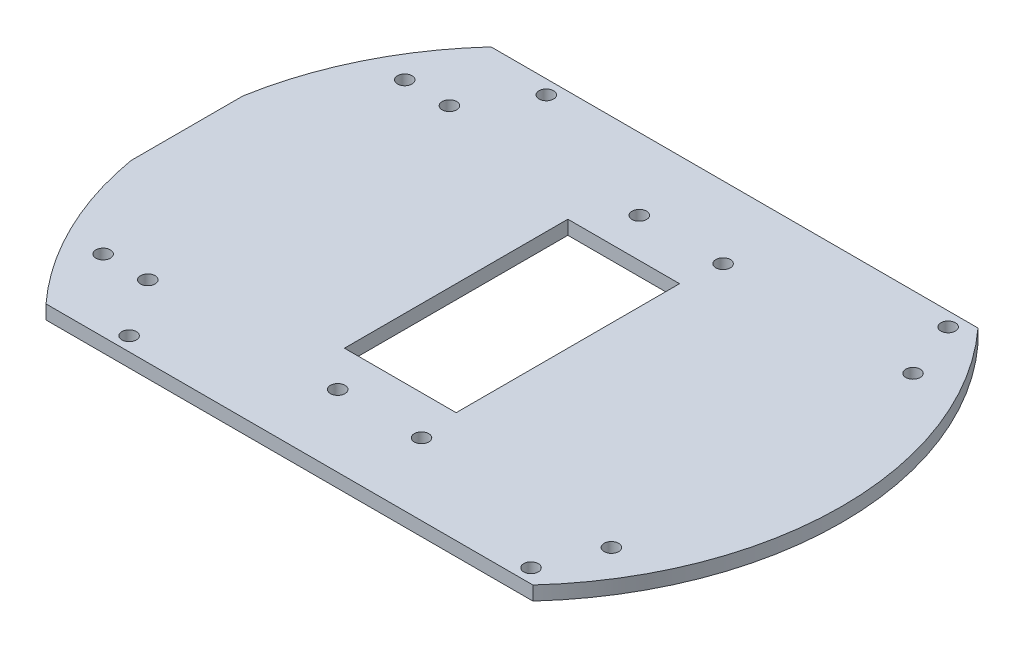
from build123d import *

# Parameters (mm, degrees)
SKETCH1_R           = 1.651
SKETCH1_W           = 25.4
SKETCH1_H           = 50.8
BOSS_EXTRUDE1_DEPTH = 3.175


with BuildPart() as part:
    # Sketch1 → Boss-Extrude1 (new body)
    with BuildSketch(Plane(origin=(0, 0, 0), x_dir=(1, 0, 0), z_dir=(0, 1, 0))):
        with BuildLine():
            Line((-73.916912814, 12.7), (-73.916912814, -12.7))
            ThreePointArc((-73.916912814, -12.7), (-67.357563081, -32.984218889), (-55.35602635, -50.603461806))
            Line((-55.35602635, -50.603461806), (55.35602635, -50.603461806))
            ThreePointArc((55.35602635, -50.603461806), (75, 0), (55.35602635, 50.603461806))
            Line((55.35602635, 50.603461806), (-55.35602635, 50.603461806))
            ThreePointArc((-55.35602635, 50.603461806), (-67.357563081, 32.984218889), (-73.916912814, 12.7))
        make_face()
        with Locations((13.713087186, 34.29)):
            Circle(SKETCH1_R, mode=Mode.SUBTRACT)
        with Locations((-58.676912814, -34.29)):
            Circle(SKETCH1_R, mode=Mode.SUBTRACT)
        with Locations((-58.676912814, 34.29)):
            Circle(SKETCH1_R, mode=Mode.SUBTRACT)
        with Locations((-39.626912814, 47.428461806)):
            Circle(SKETCH1_R, mode=Mode.SUBTRACT)
        with Locations((51.749406285, 47.428461806)):
            Circle(SKETCH1_R, mode=Mode.SUBTRACT)
        with Locations((-39.626912814, -47.428461806)):
            Circle(SKETCH1_R, mode=Mode.SUBTRACT)
        with Locations((51.749406285, -47.428461806)):
            Circle(SKETCH1_R, mode=Mode.SUBTRACT)
        with Locations((56.893087186, 34.29)):
            Circle(SKETCH1_R, mode=Mode.SUBTRACT)
        with Locations((-48.516912814, 34.29)):
            Circle(SKETCH1_R, mode=Mode.SUBTRACT)
        with Locations((-5.336912814, 34.29)):
            Circle(SKETCH1_R, mode=Mode.SUBTRACT)
        with Locations((-5.336912814, -34.29)):
            Circle(SKETCH1_R, mode=Mode.SUBTRACT)
        with Locations((-48.516912814, -34.29)):
            Circle(SKETCH1_R, mode=Mode.SUBTRACT)
        with Locations((13.713087186, -34.29)):
            Circle(SKETCH1_R, mode=Mode.SUBTRACT)
        with Locations((56.893087186, -34.29)):
            Circle(SKETCH1_R, mode=Mode.SUBTRACT)
        Rectangle(SKETCH1_W, SKETCH1_H, mode=Mode.SUBTRACT)
    extrude(amount=BOSS_EXTRUDE1_DEPTH)


solid = part.part
